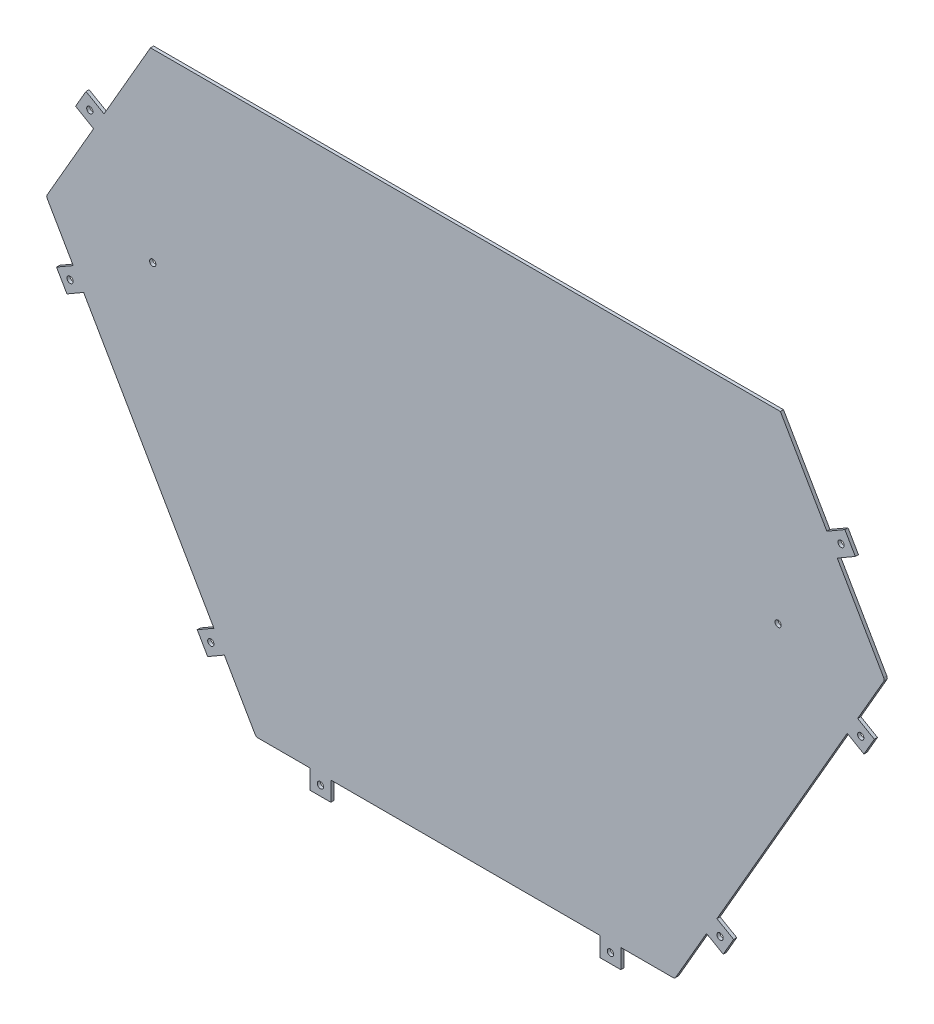
from build123d import *

# Parameters (mm, degrees)
SKETCH_1_R              = 3
EXTRUDE_1_DEPTH         = 1.5
SHEET_START             = -1.5
SHEET_METAL_1_OUTLINE_R = 3
SHEET_METAL_1_DEPTH     = 1.5


# Read off the part's stored shape, not the designer's step: Преобразовать-Твердое тело1
with BuildPart() as part:
    # Sketch 1 → Бобышка-Вытянуть1 (new body)
    with BuildSketch(Plane.XY):
        with BuildLine():
            Line((201.732050808, -332.910161514), (231.299038106, -281.698637287))
            Line((231.299038106, -281.698637287), (247.320508076, -290.948637287))
            Line((247.320508076, -290.948637287), (257.320508076, -273.628129211))
            Line((257.320508076, -273.628129211), (241.299038106, -264.378129211))
            Line((241.299038106, -264.378129211), (366.299038106, -47.871778265))
            Line((366.299038106, -47.871778265), (382.320508076, -57.121778265))
            Line((382.320508076, -57.121778265), (392.320508076, -39.801270189))
            Line((392.320508076, -39.801270189), (376.299038106, -30.551270189))
            Line((376.299038106, -30.551270189), (401.299038106, 12.75))
            ThreePointArc((401.299038106, 12.75), (401.700961894, 14.25), (401.299038106, 15.75))
            Line((401.299038106, 15.75), (356.732050808, 92.942286341))
            Line((356.732050808, 92.942286341), (374.052558883, 102.942286341))
            Line((374.052558883, 102.942286341), (364.052558883, 120.262794416))
            Line((364.052558883, 120.262794416), (346.732050808, 110.262794416))
            Line((346.732050808, 110.262794416), (302.165063509, 187.455080757))
            Line((302.165063509, 187.455080757), (-302.165063509, 187.455080757))
            Line((-302.165063509, 187.455080757), (-346.732050808, 110.262794416))
            Line((-346.732050808, 110.262794416), (-364.052558883, 120.262794416))
            Line((-364.052558883, 120.262794416), (-374.052558883, 102.942286341))
            Line((-374.052558883, 102.942286341), (-356.732050808, 92.942286341))
            Line((-356.732050808, 92.942286341), (-401.299038106, 15.75))
            ThreePointArc((-401.299038106, 15.75), (-401.700961894, 14.25), (-401.299038106, 12.75))
            Line((-401.299038106, 12.75), (-376.299038106, -30.551270189))
            Line((-376.299038106, -30.551270189), (-392.320508076, -39.801270189))
            Line((-392.320508076, -39.801270189), (-382.320508076, -57.121778265))
            Line((-382.320508076, -57.121778265), (-366.299038106, -47.871778265))
            Line((-366.299038106, -47.871778265), (-241.299038106, -264.378129211))
            Line((-241.299038106, -264.378129211), (-257.320508076, -273.628129211))
            Line((-257.320508076, -273.628129211), (-247.320508076, -290.948637287))
            Line((-247.320508076, -290.948637287), (-231.299038106, -281.698637287))
            Line((-231.299038106, -281.698637287), (-201.732050808, -332.910161514))
            ThreePointArc((-201.732050808, -332.910161514), (-200.633974596, -334.008237725), (-199.133974596, -334.410161514))
            Line((-199.133974596, -334.410161514), (-149.133974596, -334.410161514))
            Line((-149.133974596, -334.410161514), (-149.133974596, -352.910161514))
            Line((-149.133974596, -352.910161514), (-129.133974596, -352.910161514))
            Line((-129.133974596, -352.910161514), (-129.133974596, -334.410161514))
            Line((-129.133974596, -334.410161514), (129.133974596, -334.410161514))
            Line((129.133974596, -334.410161514), (129.133974596, -352.910161514))
            Line((129.133974596, -352.910161514), (149.133974596, -352.910161514))
            Line((149.133974596, -352.910161514), (149.133974596, -334.410161514))
            Line((149.133974596, -334.410161514), (199.133974596, -334.410161514))
            ThreePointArc((199.133974596, -334.410161514), (200.633974596, -334.008237725), (201.732050808, -332.910161514))
        make_face()
        with Locations((244.309773091, -277.663383249)):
            Circle(SKETCH_1_R, mode=Mode.SUBTRACT)
        with Locations((379.309773091, -43.836524227)):
            Circle(SKETCH_1_R, mode=Mode.SUBTRACT)
        with Locations((139.133974596, -343.660161514)):
            Circle(SKETCH_1_R, mode=Mode.SUBTRACT)
        with Locations((-139.133974596, -343.660161514)):
            Circle(SKETCH_1_R, mode=Mode.SUBTRACT)
        with Locations((-244.309773091, -277.663383249)):
            Circle(SKETCH_1_R, mode=Mode.SUBTRACT)
        with Locations((-379.309773091, -43.836524227)):
            Circle(SKETCH_1_R, mode=Mode.SUBTRACT)
        with Locations((300, 10)):
            Circle(SKETCH_1_R, mode=Mode.SUBTRACT)
        with Locations((-300, 10)):
            Circle(SKETCH_1_R, mode=Mode.SUBTRACT)
        with Locations((-360.392304845, 106.602540379)):
            Circle(SKETCH_1_R, mode=Mode.SUBTRACT)
        with Locations((360.392304845, 106.602540379)):
            Circle(SKETCH_1_R, mode=Mode.SUBTRACT)
    extrude(amount=EXTRUDE_1_DEPTH)

    # Sheet Metal 1 outline → Sheet Metal 1 (add)
    with BuildSketch(Plane.XY.offset(SHEET_START)):
        with BuildLine():
            Line((-199.133974596, -334.410161514), (-149.133974596, -334.410161514))
            Line((-149.133974596, -334.410161514), (-149.133974596, -352.910161514))
            Line((-149.133974596, -352.910161514), (-129.133974596, -352.910161514))
            Line((-129.133974596, -352.910161514), (-129.133974596, -334.410161514))
            Line((-129.133974596, -334.410161514), (129.133974596, -334.410161514))
            Line((129.133974596, -334.410161514), (129.133974596, -352.910161514))
            Line((129.133974596, -352.910161514), (149.133974596, -352.910161514))
            Line((149.133974596, -352.910161514), (149.133974596, -334.410161514))
            Line((149.133974596, -334.410161514), (199.133974596, -334.410161514))
            ThreePointArc((199.133974596, -334.410161514), (200.633974596, -334.008237725), (201.732050808, -332.910161514))
            Line((201.732050808, -332.910161514), (231.299038106, -281.698637287))
            Line((231.299038106, -281.698637287), (247.320508076, -290.948637287))
            Line((247.320508076, -290.948637287), (257.320508076, -273.628129211))
            Line((257.320508076, -273.628129211), (241.299038106, -264.378129211))
            Line((241.299038106, -264.378129211), (366.299038106, -47.871778265))
            Line((366.299038106, -47.871778265), (382.320508076, -57.121778265))
            Line((382.320508076, -57.121778265), (392.320508076, -39.801270189))
            Line((392.320508076, -39.801270189), (376.299038106, -30.551270189))
            Line((376.299038106, -30.551270189), (401.299038106, 12.75))
            ThreePointArc((401.299038106, 12.75), (401.700961894, 14.25), (401.299038106, 15.75))
            Line((401.299038106, 15.75), (356.732050808, 92.942286341))
            Line((356.732050808, 92.942286341), (374.052558883, 102.942286341))
            Line((374.052558883, 102.942286341), (364.052558883, 120.262794416))
            Line((364.052558883, 120.262794416), (346.732050808, 110.262794416))
            Line((346.732050808, 110.262794416), (302.165063509, 187.455080757))
            Line((302.165063509, 187.455080757), (-302.165063509, 187.455080757))
            Line((-302.165063509, 187.455080757), (-346.732050808, 110.262794416))
            Line((-346.732050808, 110.262794416), (-364.052558883, 120.262794416))
            Line((-364.052558883, 120.262794416), (-374.052558883, 102.942286341))
            Line((-374.052558883, 102.942286341), (-356.732050808, 92.942286341))
            Line((-356.732050808, 92.942286341), (-401.299038106, 15.75))
            ThreePointArc((-401.299038106, 15.75), (-401.700961894, 14.25), (-401.299038106, 12.75))
            Line((-401.299038106, 12.75), (-376.299038106, -30.551270189))
            Line((-376.299038106, -30.551270189), (-392.320508076, -39.801270189))
            Line((-392.320508076, -39.801270189), (-382.320508076, -57.121778265))
            Line((-382.320508076, -57.121778265), (-366.299038106, -47.871778265))
            Line((-366.299038106, -47.871778265), (-241.299038106, -264.378129211))
            Line((-241.299038106, -264.378129211), (-257.320508076, -273.628129211))
            Line((-257.320508076, -273.628129211), (-247.320508076, -290.948637287))
            Line((-247.320508076, -290.948637287), (-231.299038106, -281.698637287))
            Line((-231.299038106, -281.698637287), (-201.732050808, -332.910161514))
            ThreePointArc((-201.732050808, -332.910161514), (-200.633974596, -334.008237725), (-199.133974596, -334.410161514))
        make_face()
        with Locations((-244.309773091, -277.663383249)):
            Circle(SHEET_METAL_1_OUTLINE_R, mode=Mode.SUBTRACT)
        with Locations((-139.133974596, -343.660161514)):
            Circle(SHEET_METAL_1_OUTLINE_R, mode=Mode.SUBTRACT)
        with Locations((139.133974596, -343.660161514)):
            Circle(SHEET_METAL_1_OUTLINE_R, mode=Mode.SUBTRACT)
        with Locations((244.309773091, -277.663383249)):
            Circle(SHEET_METAL_1_OUTLINE_R, mode=Mode.SUBTRACT)
        with Locations((-379.309773091, -43.836524227)):
            Circle(SHEET_METAL_1_OUTLINE_R, mode=Mode.SUBTRACT)
        with Locations((-300, 10)):
            Circle(SHEET_METAL_1_OUTLINE_R, mode=Mode.SUBTRACT)
        with Locations((-360.392304845, 106.602540379)):
            Circle(SHEET_METAL_1_OUTLINE_R, mode=Mode.SUBTRACT)
        with Locations((379.309773091, -43.836524227)):
            Circle(SHEET_METAL_1_OUTLINE_R, mode=Mode.SUBTRACT)
        with Locations((300, 10)):
            Circle(SHEET_METAL_1_OUTLINE_R, mode=Mode.SUBTRACT)
        with Locations((360.392304845, 106.602540379)):
            Circle(SHEET_METAL_1_OUTLINE_R, mode=Mode.SUBTRACT)
    extrude(amount=SHEET_METAL_1_DEPTH)


solid = part.part
